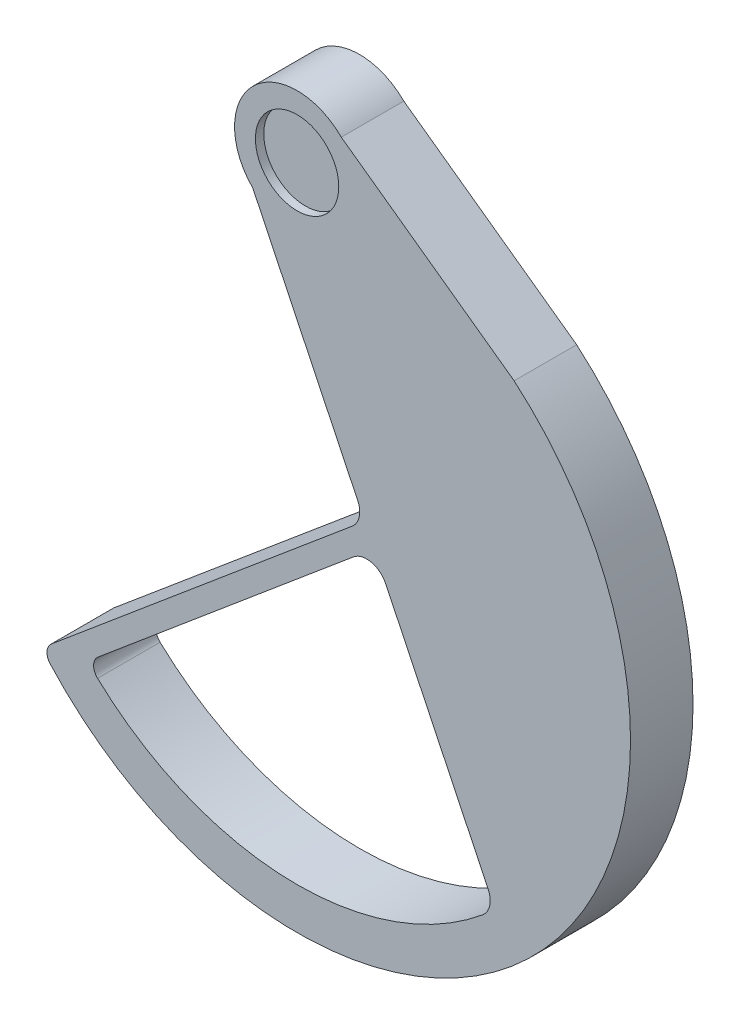
from build123d import *

# Parameters (mm, degrees)
EXTRUDE_1_DEPTH     = 15
SKETCH_5_R          = 10
CUT_EXTRUDE_2_DEPTH = 2


with BuildPart() as part:
    # ｽｹｯﾁ4 → ﾎﾞｽ - 押し出し1 (new body)
    with BuildSketch(Plane.XY):
        with BuildLine():
            Line((13.244185189, -68.886809092), (-53.623111018, -124.995132678))
            Line((-53.623111018, -124.995132678), (-58.940636287, -129.45706617))
            ThreePointArc((-58.940636287, -129.45706617), (-60.005384698, -131.552012131), (-59.233530865, -133.771635843))
            ThreePointArc((-59.233530865, -133.771635843), (-58.595754044, -134.465930709), (-57.949839695, -135.15266158))
            ThreePointArc((-57.949839695, -135.15266158), (58.01545948, -135.083631519), (52.076178918, -19.270504783))
            Line((52.076178918, -19.270504783), (10.606601718, 10.606601718))
            ThreePointArc((10.606601718, 10.606601718), (-10.606601718, 10.606601718), (-10.606601718, -10.606601718))
            Line((-10.606601718, -10.606601718), (14.536280154, -62.889638219))
            ThreePointArc((14.536280154, -62.889638219), (14.918089499, -66.109676181), (13.244185189, -68.886809092))
        make_face()
        with BuildLine():
            ThreePointArc((13.511229465, -75.151532228), (17.77869109, -74.092739753), (21.232400696, -76.813798404))
            Line((21.232400696, -76.813798404), (45.844843506, -127.993820346))
            ThreePointArc((45.844843506, -127.993820346), (46.221944165, -131.235480845), (44.518718993, -134.019289696))
            ThreePointArc((44.518718993, -134.019289696), (-2.231208213, -149.964431749), (-47.870174388, -131.072951785))
            ThreePointArc((-47.870174388, -131.072951785), (-48.817477846, -128.802229421), (-47.747678417, -126.586582094))
            Line((-47.747678417, -126.586582094), (13.511229465, -75.151532228))
        make_face(mode=Mode.SUBTRACT)
    extrude(amount=EXTRUDE_1_DEPTH)

    # ｽｹｯﾁ5 → ｶｯﾄ - 押し出し2 (cut)
    with BuildSketch(Plane.XY.offset(15)):
        Circle(SKETCH_5_R)
    extrude(amount=-CUT_EXTRUDE_2_DEPTH, mode=Mode.SUBTRACT)


solid = part.part
